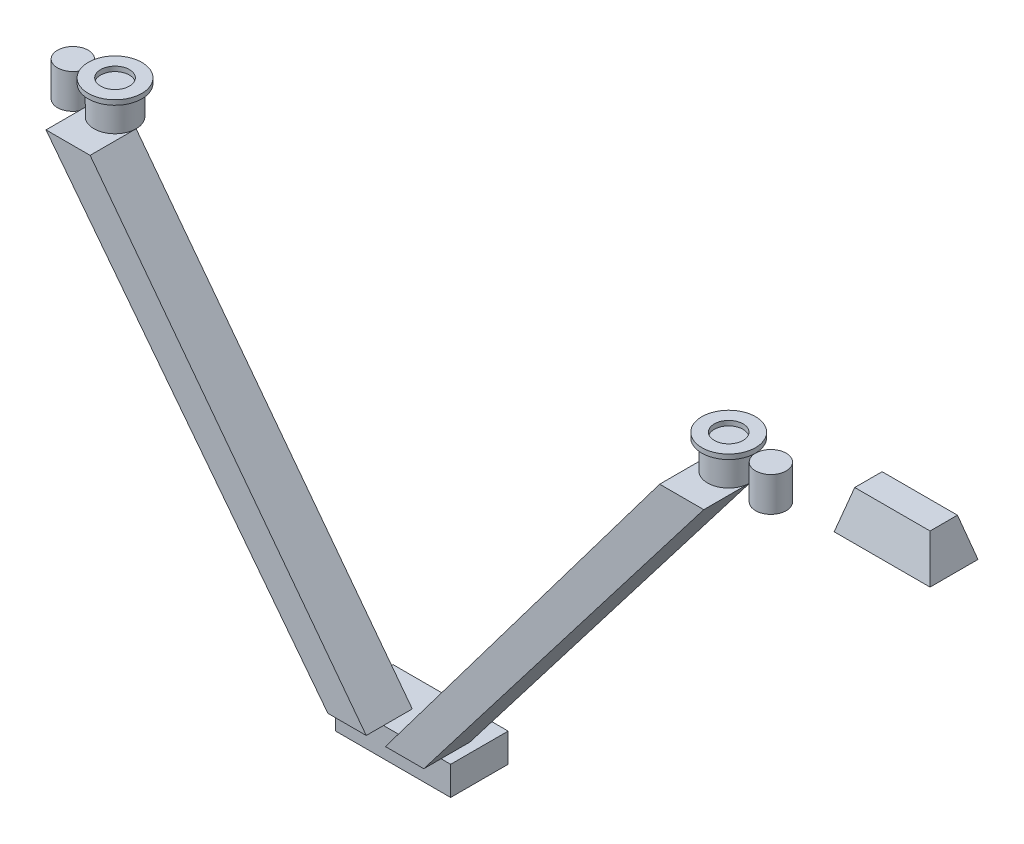
from build123d import *

# Parameters (mm, degrees)
BOSS_EXTRUDE1_START  = 3325
SKETCH1_R            = 140
SKETCH1_R_2          = 75
BOSS_EXTRUDE1_DEPTH  = 25
BOSS_EXTRUDE2_START  = 3300
SKETCH2_R            = 110
BOSS_EXTRUDE2_DEPTH  = 150
BOSS_EXTRUDE3_START  = 3120
SKETCH3_R            = 80
BOSS_EXTRUDE3_DEPTH  = 180
BOSS_EXTRUDE4_START  = 3325
SKETCH4_R            = 140
SKETCH4_R_2          = 75
BOSS_EXTRUDE4_DEPTH  = 25
BOSS_EXTRUDE5_START  = 3300
SKETCH5_R            = 110
BOSS_EXTRUDE5_DEPTH  = 150
BOSS_EXTRUDE6_START  = 3120
SKETCH6_R            = 80
BOSS_EXTRUDE6_DEPTH  = 180
BOSS_EXTRUDE7_DEPTH  = 240
BOSS_EXTRUDE8_DEPTH  = 240
BOSS_EXTRUDE9_START  = 1100
SKETCH9_W            = 600
SKETCH9_H            = 300
BOSS_EXTRUDE9_DEPTH  = 150
BOSS_EXTRUDE10_START = 750
SKETCH10_W           = 500
SKETCH10_H           = 250
BOSS_EXTRUDE10_DEPTH = 200
BOSS_EXTRUDE10_TAPER = 15


with BuildPart() as part:
    # Sketch1 → Boss-Extrude1 (new body)
    with BuildSketch(Plane(origin=(0, 0, 0), x_dir=(1, 0, 0), z_dir=(0, 1, 0)).offset(BOSS_EXTRUDE1_START)):
        with Locations((-1600, 0)):
            Circle(SKETCH1_R)
        with Locations((-1600, 0)):
            Circle(SKETCH1_R_2, mode=Mode.SUBTRACT)
    extrude(amount=-BOSS_EXTRUDE1_DEPTH)

    # Sketch2 → Boss-Extrude2 (add)
    with BuildSketch(Plane(origin=(0, 0, 0), x_dir=(1, 0, 0), z_dir=(0, 1, 0)).offset(BOSS_EXTRUDE2_START)):
        with Locations((-1600, 0)):
            Circle(SKETCH2_R)
    extrude(amount=-BOSS_EXTRUDE2_DEPTH)

    # Sketch7 → Boss-Extrude7 (add)
    with BuildSketch(Plane.XY):
        Polygon((-1720, 3150), (-1490, 3150), (-50, 1250), (-250, 1250), align=None)
    extrude(amount=BOSS_EXTRUDE7_DEPTH)



with BuildPart() as body_2:
    # Sketch3 → Boss-Extrude3 (new body)
    with BuildSketch(Plane(origin=(0, 0, 0), x_dir=(1, 0, 0), z_dir=(0, 1, 0)).offset(BOSS_EXTRUDE3_START)):
        with Locations((-1820, 0)):
            Circle(SKETCH3_R)
    extrude(amount=BOSS_EXTRUDE3_DEPTH)


with BuildPart() as body_3:
    # Sketch4 → Boss-Extrude4 (new body)
    with BuildSketch(Plane(origin=(0, 0, 0), x_dir=(1, 0, 0), z_dir=(0, 1, 0)).offset(BOSS_EXTRUDE4_START)):
        with Locations((1600, 0)):
            Circle(SKETCH4_R)
        with Locations((1600, 0)):
            Circle(SKETCH4_R_2, mode=Mode.SUBTRACT)
    extrude(amount=-BOSS_EXTRUDE4_DEPTH)

    # Sketch5 → Boss-Extrude5 (add)
    with BuildSketch(Plane(origin=(0, 0, 0), x_dir=(1, 0, 0), z_dir=(0, 1, 0)).offset(BOSS_EXTRUDE5_START)):
        with Locations((1600, 0)):
            Circle(SKETCH5_R)
    extrude(amount=-BOSS_EXTRUDE5_DEPTH)

    # Sketch8 → Boss-Extrude8 (add)
    with BuildSketch(Plane.XY):
        Polygon((1480, 3150), (1710, 3150), (250, 1250), (50, 1250), align=None)
    extrude(amount=BOSS_EXTRUDE8_DEPTH)


with BuildPart() as body_4:
    # Sketch6 → Boss-Extrude6 (new body)
    with BuildSketch(Plane(origin=(0, 0, 0), x_dir=(1, 0, 0), z_dir=(0, 1, 0)).offset(BOSS_EXTRUDE6_START)):
        with Locations((1820, 0)):
            Circle(SKETCH6_R)
    extrude(amount=BOSS_EXTRUDE6_DEPTH)


with BuildPart() as part_1:
    add(part.part)

    add(body_3.part)  # Boss-Extrude9 merges body 3
    # Sketch9 → Boss-Extrude9 (add)
    with BuildSketch(Plane(origin=(0, 0, 0), x_dir=(1, 0, 0), z_dir=(0, 1, 0)).offset(BOSS_EXTRUDE9_START)):
        Rectangle(SKETCH9_W, SKETCH9_H)
    extrude(amount=BOSS_EXTRUDE9_DEPTH)


with BuildPart() as body_4_2:
    # Sketch10 → Boss-Extrude10 (new body)
    with BuildSketch(Plane(origin=(0, 0, 0), x_dir=(1, 0, 0), z_dir=(0, 1, 0)).offset(BOSS_EXTRUDE10_START)):
        with Locations((0, 2525)):
            Rectangle(SKETCH10_W, SKETCH10_H)
    extrude(amount=BOSS_EXTRUDE10_DEPTH, taper=BOSS_EXTRUDE10_TAPER)


solid = Compound([body_2.part, body_4.part, part_1.part, body_4_2.part])
